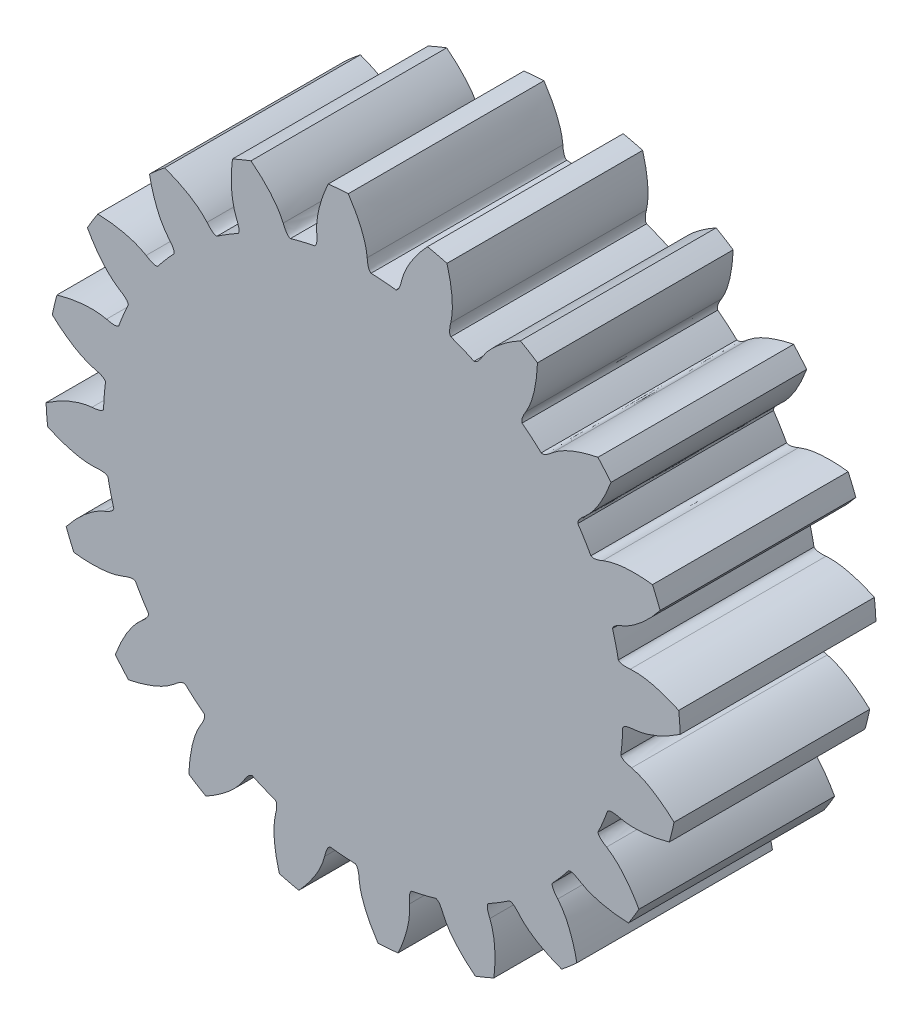
from build123d import *

# Parameters (mm, degrees)
SKETCH2_R           = 13.97
BOSS_EXTRUDE1_DEPTH = 4.305721593
CUT_EXTRUDE1_DEPTH  = 22.551769156
CIRPATTERN1_COUNT   = 20


with BuildPart() as part:
    # Sketch2 → Boss-Extrude1 (new, symmetric)
    with BuildSketch(Plane.XY):
        Circle(SKETCH2_R)
    extrude(amount=BOSS_EXTRUDE1_DEPTH, both=True)

    # Sketch3 → Cut-Extrude1 (cut, symmetric)
    with BuildSketch(Plane.XY.offset(4.305721593)):
        with BuildLine():
            ThreePointArc((0.345548376, 11.424775548), (0.896787464, 11.394765125), (1.445934549, 11.338173278))
            add(Edge.make_bspline(
                [(1.691022645, 11.813682598), (1.673369892, 11.72306203), (1.621683604, 11.548720261), (1.535356786, 11.380537451), (1.445934549, 11.338173278)],
                knots=[0, 0, 0, 0, 0.5, 1, 1, 1, 1], degree=3))
            add(Edge.make_bspline(
                [(2.830619385, 13.680222728), (2.615430822, 13.44971467), (2.148718568, 12.878963122), (1.796650693, 12.226075683), (1.691022645, 11.813682598)],
                knots=[0, 0, 0, 0, 0.428684194, 1, 1, 1, 1], degree=3))
            ThreePointArc((2.830619385, 13.680222728), (1.096073567, 13.926935152), (-0.65571144, 13.954602915))
            add(Edge.make_bspline(
                [(-0.65571144, 13.954602915), (-0.479231609, 13.693269885), (-0.10755057, 13.056535354), (0.138048668, 12.356610494), (0.177863767, 11.932770785)],
                knots=[0, 0, 0, 0, 0.428684194, 1, 1, 1, 1], degree=3))
            add(Edge.make_bspline(
                [(0.177863767, 11.932770785), (0.181123005, 11.840504407), (0.204899888, 11.660223557), (0.263854291, 11.480606868), (0.345548376, 11.424775548)],
                knots=[0, 0, 0, 0, 0.5, 1, 1, 1, 1], degree=3))
        make_face()
    cut_extrude1 = extrude(amount=CUT_EXTRUDE1_DEPTH, both=True, mode=Mode.SUBTRACT)

    # CirPattern1: Cut-Extrude1 ×20 about axis
    cirpattern1_axis = Axis((0, 0, 4.305721593), (0, 0, -1))
    for i in range(1, CIRPATTERN1_COUNT):
        add(cut_extrude1.rotate(cirpattern1_axis, i * 360 / CIRPATTERN1_COUNT), mode=Mode.SUBTRACT)


solid = part.part
